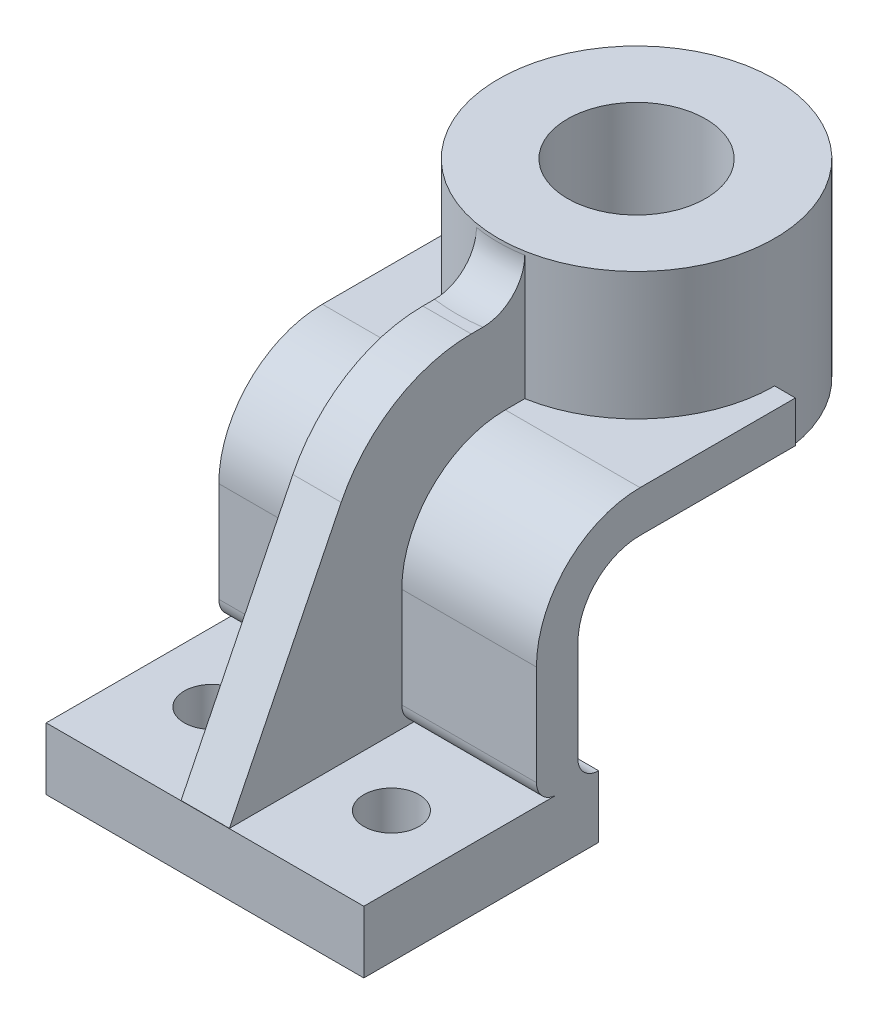
from build123d import *

# Parameters (mm, degrees)
SKETCH1_W                = 2336.8
SKETCH1_H                = 1727.2
BOSS_EXTRUDE1_DEPTH      = 457.2
SKETCH2_R                = 203.2
CUT_EXTRUDE1_DEPTH       = 1836.452141677
BOSS_EXTRUDE2_DEPTH      = 2336.8
FILLET2_R                = 152.4
BOSS_EXTRUDE3_DEPTH      = 939.8
BOSS_EXTRUDE3_DEPTH_BACK = 457.2
SKETCH5_R                = 1016
SKETCH6_R                = 508
CUT_EXTRUDE2_DEPTH       = 4335.234786449
RIB1_START               = -177.8
RIB1_DEPTH               = 355.6
FILLET3_R                = 1066.8
FILLET4_R                = 304.8


# Read off the part's stored shape, not the designer's step: Rib1
with BuildPart() as part:
    # Sketch1 → Boss-Extrude1 (new body)
    with BuildSketch(Plane(origin=(0, 0, 0), x_dir=(1, 0, 0), z_dir=(0, 1, 0))):
        with Locations((0, -476.061958998)):
            Rectangle(SKETCH1_W, SKETCH1_H)
    extrude(amount=BOSS_EXTRUDE1_DEPTH)

    # Sketch2 → Cut-Extrude1 (cut, through all)
    with BuildSketch(Plane(origin=(0, 457.2, 0), x_dir=(1, 0, 0), z_dir=(0, 1, 0))):
        with Locations(Location((-660.4, -628.461958998, 0), (0, 0, 270))):
            Circle(SKETCH2_R)
        with Locations(Location((660.4, -628.461958998, 0), (0, 0, 270))):
            Circle(SKETCH2_R)
    extrude(amount=-CUT_EXTRUDE1_DEPTH, mode=Mode.SUBTRACT)

    # Sketch4 → Boss-Extrude2 (add, through all)
    with BuildSketch(Plane(origin=(1168.4, 0, 0), x_dir=(0, 0, -1), z_dir=(1, 0, 0))):
        with BuildLine():
            Line((235.138041002, 457.2), (235.138041002, 1346.2))
            ThreePointArc((235.138041002, 1346.2), (369.048820644, 1669.489220358), (692.338041002, 1803.4))
            Line((692.338041002, 1803.4), (1835.338041002, 1803.4))
            Line((1835.338041002, 1803.4), (1835.338041002, 2108.2))
            Line((1835.338041002, 2108.2), (692.338041002, 2108.2))
            ThreePointArc((692.338041002, 2108.2), (153.522673738, 1885.015367264), (-69.661958998, 1346.2))
            Line((-69.661958998, 1346.2), (-69.661958998, 609.6))
            ThreePointArc((-69.661958998, 609.6), (-25.025032451, 501.836926547), (82.738041002, 457.2))
            Line((82.738041002, 457.2), (235.138041002, 457.2))
        make_face()
    extrude(amount=-BOSS_EXTRUDE2_DEPTH)

    # Fillet2
    fillet2_edges = [part.edges().sort_by_distance(p)[0] for p in [
        (0, 457.2, -235.138041002),
    ]]
    fillet(fillet2_edges, radius=FILLET2_R - 0.0001)  # a hair under: the kernel refuses the full size

    # Sketch5 → Boss-Extrude3 (add, two sides: drawn at the far end of the back side and taken through both)
    with BuildSketch(Plane(origin=(0, 2108.2, 0), x_dir=(1, 0, 0), z_dir=(0, 1, 0)).offset(-BOSS_EXTRUDE3_DEPTH_BACK)):
        with Locations(Location((0, 1835.338041002, 0), (0, 0, 270))):
            Circle(SKETCH5_R)
    extrude(amount=BOSS_EXTRUDE3_DEPTH + BOSS_EXTRUDE3_DEPTH_BACK)

    # Sketch6 → Cut-Extrude2 (cut, through all)
    with BuildSketch(Plane(origin=(0, 3048, 0), x_dir=(1, 0, 0), z_dir=(0, 1, 0))):
        with Locations(Location((0, 1835.338041002, 0), (0, 0, 270))):
            Circle(SKETCH6_R)
    extrude(amount=-CUT_EXTRUDE2_DEPTH, mode=Mode.SUBTRACT)

    # Rib1 outline → Rib1 (add)
    with BuildSketch(Plane(origin=(0, 0, 0), x_dir=(0, 0, -1), z_dir=(1, 0, 0)).offset(RIB1_START)):
        with BuildLine():
            Line((837, 2717.8), (-222.061958998, 2717.8))
            Line((-222.061958998, 2717.8), (-1337.953329415, 457.2))
            Line((-1337.953329415, 457.2), (82.738041002, 457.2))
            ThreePointArc((82.738041002, 457.2), (-25.025032451, 501.836926547), (-69.661958998, 609.6))
            Line((-69.661958998, 609.6), (-69.661958998, 1346.2))
            ThreePointArc((-69.661958998, 1346.2), (153.522673738, 1885.015367264), (692.338041002, 2108.2))
            Line((692.338041002, 2108.2), (837, 2108.2))
            Line((837, 2108.2), (837, 2717.8))
        make_face()
    extrude(amount=RIB1_DEPTH)

    # Fillet3
    fillet3_edges = [part.edges().sort_by_distance(p)[0] for p in [
        (0, 2717.8, 222.061958998),
    ]]
    fillet(fillet3_edges, radius=FILLET3_R)

    # Fillet4
    fillet4_edges = [part.edges().sort_by_distance(p)[0] for p in [
        (89.244964108, 2717.8, -823.265248965),
    ]]
    fillet(fillet4_edges, radius=FILLET4_R)


solid = part.part
